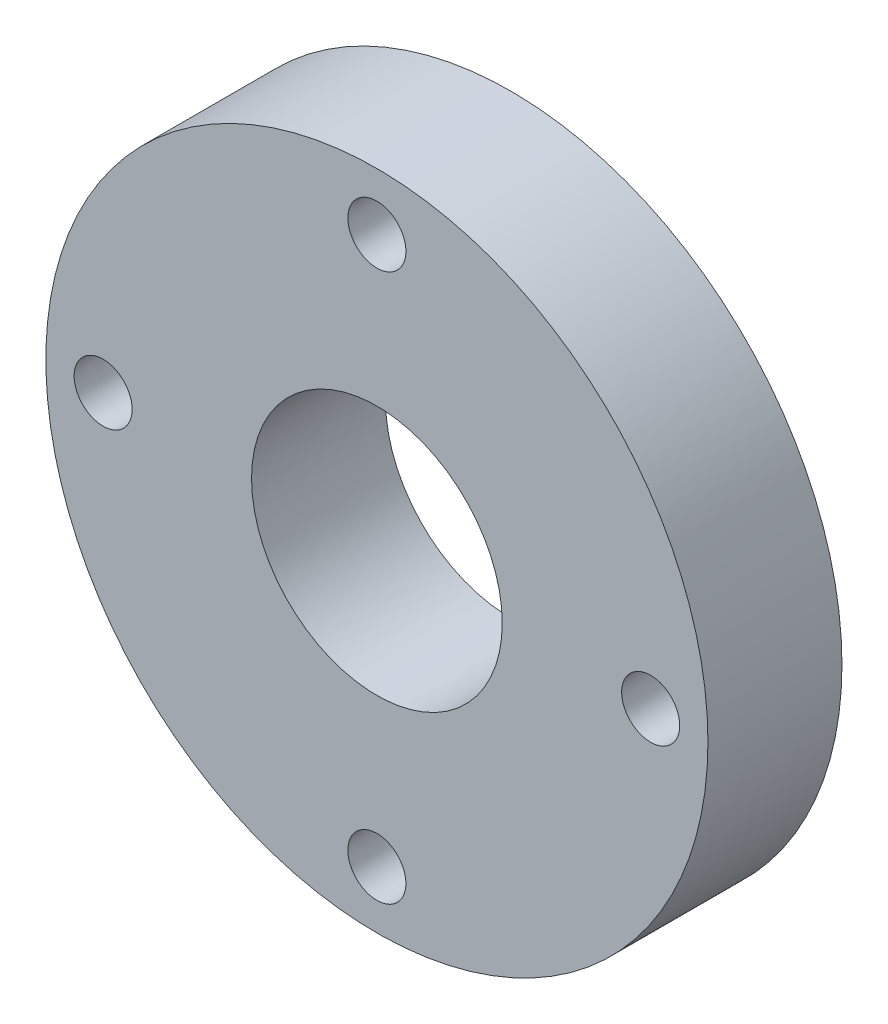
from build123d import *

# Parameters (mm, degrees)
SKETCH1_W            = 15.24
SKETCH1_H            = 28.12415
SKETCH5_R            = 14.25575
SEAL_SEAT_DEPTH      = 56.382078251
M6_CLEARANCE_HOLE1_D = 6.6
CIRPATTERN1_COUNT    = 4


with BuildPart() as part:
    # Sketch1 → Main_body (revolve)
    with BuildSketch(Plane(origin=(0, 0, 0), x_dir=(0, 0, -1), z_dir=(1, 0, 0))):
        with Locations((-127.089000076, 23.587075)):
            Rectangle(SKETCH1_W, SKETCH1_H)
    revolve(axis=Axis((0, 0, 1000), (0, 0, -1)))

    # Sketch5 → seal_seat (cut, through all)
    with BuildSketch(Plane.XY.offset(134.709000076)):
        Circle(SKETCH5_R)
    extrude(amount=-SEAL_SEAT_DEPTH, mode=Mode.SUBTRACT)

    # M6 Clearance Hole1 (through all)
    with Locations(Plane.XY.offset(134.709000076)):
        with Locations((0, 31.133925032)):
            m6_clearance_hole1 = Hole(M6_CLEARANCE_HOLE1_D / 2)

    # CirPattern1: M6 Clearance Hole1 ×4 about axis
    cirpattern1_axis = Axis((0, 0, 1000), (0, 0, -1))
    for i in range(1, CIRPATTERN1_COUNT):
        add(m6_clearance_hole1.rotate(cirpattern1_axis, i * 360 / CIRPATTERN1_COUNT), mode=Mode.SUBTRACT)


solid = part.part
